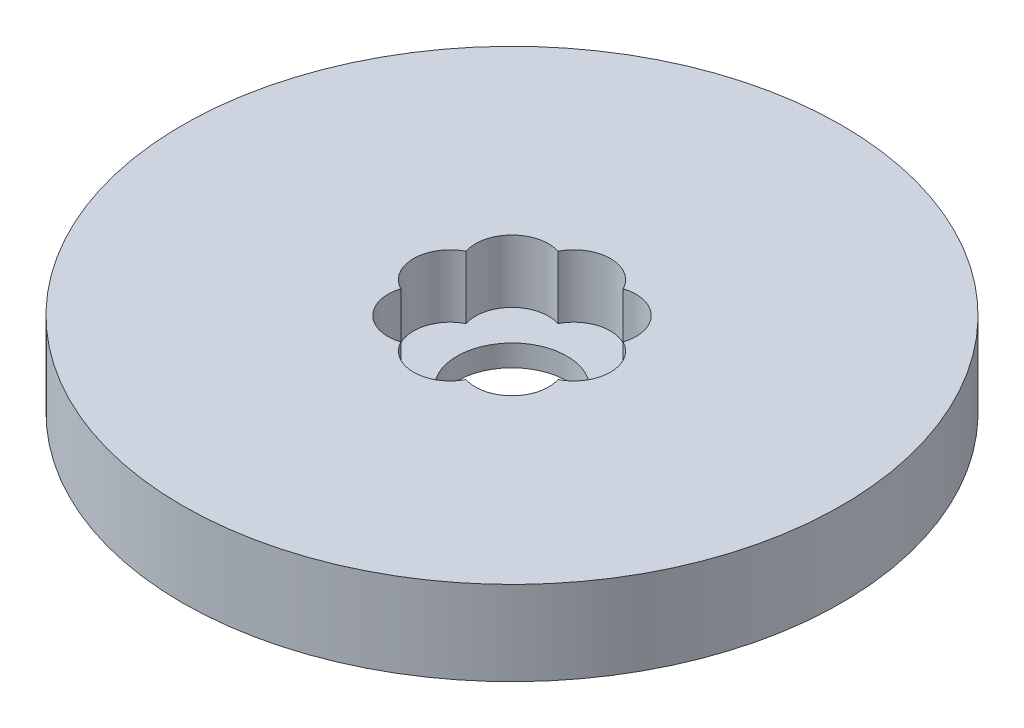
from build123d import *

# Parameters (mm, degrees)
SKETCH1_R           = 90
BOSS_EXTRUDE1_DEPTH = 23
SKETCH2_R           = 15
CUT_EXTRUDE1_DEPTH  = 130.340635533
SKETCH3_R           = 10
CUT_EXTRUDE2_DEPTH  = 17.126747947
CIRPATTERN1_COUNT   = 8


with BuildPart() as part:
    # Sketch1 → Boss-Extrude1 (new body)
    with BuildSketch(Plane(origin=(0, 0, 0), x_dir=(1, 0, 0), z_dir=(0, 1, 0))):
        Circle(SKETCH1_R)
    extrude(amount=BOSS_EXTRUDE1_DEPTH)

    # Sketch2 → Cut-Extrude1 (cut, through all)
    with BuildSketch(Plane(origin=(0, 0, 0), x_dir=(1, 0, 0), z_dir=(0, 1, 0))):
        Circle(SKETCH2_R)
    extrude(amount=CUT_EXTRUDE1_DEPTH, mode=Mode.SUBTRACT)

    # Sketch3 → Cut-Extrude2 (cut)
    with BuildSketch(Plane(origin=(0, 23, 0), x_dir=(1, 0, 0), z_dir=(0, 1, 0))):
        with Locations((-16.889819283, 0)):
            Circle(SKETCH3_R)
    cut_extrude2 = extrude(amount=-CUT_EXTRUDE2_DEPTH, mode=Mode.SUBTRACT)

    # CirPattern1: Cut-Extrude2 ×8 about axis
    cirpattern1_axis = Axis((0, 0, 0), (0, 1, 0))
    for i in range(1, CIRPATTERN1_COUNT):
        add(cut_extrude2.rotate(cirpattern1_axis, i * 360 / CIRPATTERN1_COUNT), mode=Mode.SUBTRACT)


solid = part.part
